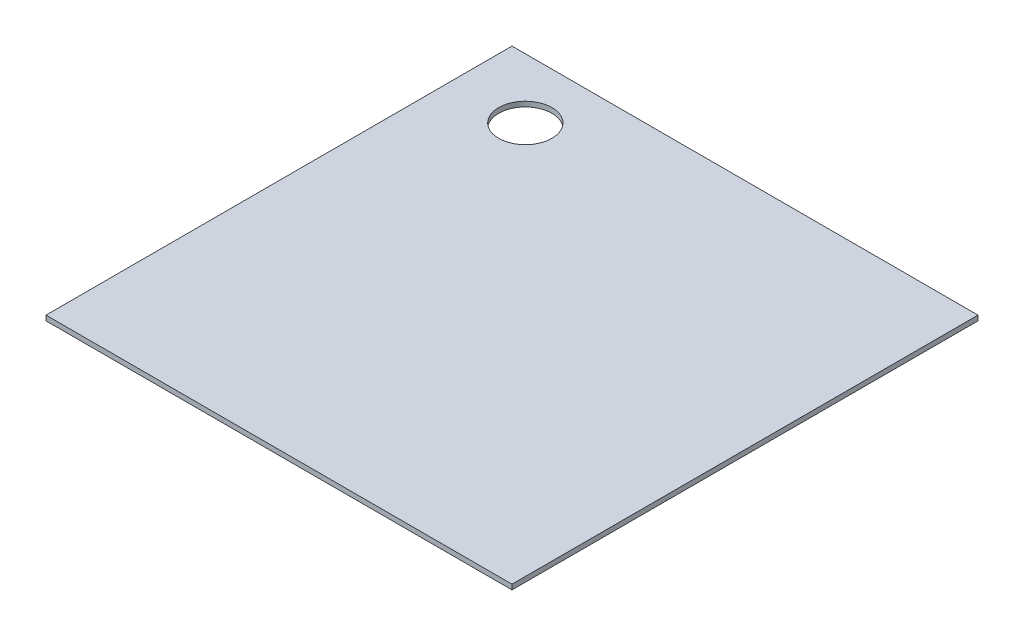
from build123d import *

# Parameters (mm, degrees)
SKETCH1_W           = 280
SKETCH1_H           = 280
SKETCH1_R           = 16
BOSS_EXTRUDE1_DEPTH = 1.5


with BuildPart() as part:
    # Sketch1 → Boss-Extrude1 (new, symmetric)
    with BuildSketch(Plane(origin=(0, 0, 0), x_dir=(1, 0, 0), z_dir=(0, 1, 0))):
        Rectangle(SKETCH1_W, SKETCH1_H)
        with Locations((-96, 104)):
            Circle(SKETCH1_R, mode=Mode.SUBTRACT)
    extrude(amount=BOSS_EXTRUDE1_DEPTH, both=True)


solid = part.part
